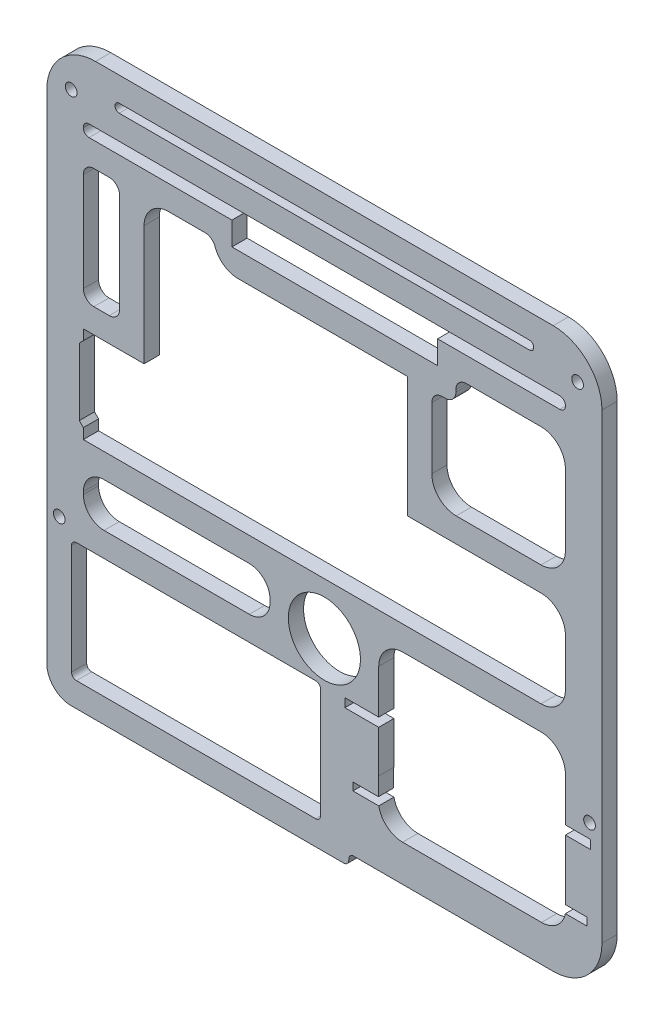
from build123d import *

# Parameters (mm, degrees)
SKETCH1_W           = 57.8674
SKETCH1_H           = 58.2902
SKETCH1_W_2         = 50.2474
SKETCH1_H_2         = 50.6702
BOSS_EXTRUDE1_DEPTH = 1.5875
SKETCH2_W           = 50.2474
SKETCH2_H           = 2.54
SKETCH2_H_2         = 2.1717
BOSS_EXTRUDE2_DEPTH = 1.5875
BOSS_EXTRUDE3_DEPTH = 1.5875
SKETCH4_W           = 11.3284
SKETCH4_H           = 17.169
BOSS_EXTRUDE4_DEPTH = 1.5875
SKETCH5_R           = 3.7592
SKETCH5_W           = 25.9588
SKETCH5_H           = 12.4587
CUT_EXTRUDE1_DEPTH  = 1.5875
SKETCH8_W           = 19.4595
SKETCH8_H           = 2.54
BOSS_EXTRUDE5_DEPTH = 1.5875
FILLET1_R           = 5.08
FILLET2_START       = -1
FILLET2_DEPTH       = 4
FILLET2_2_DEPTH     = 1.5875
FILLET3_R           = 1.0922
FILLET4_R           = 0.5842
FILLET8_R           = 2.159
SKETCH6_R           = 0.6096
CUT_EXTRUDE2_DEPTH  = 1.5875
SKETCH7_W           = 24.384
SKETCH7_H           = 0.8128
SKETCH7_W_2         = 19.05
SKETCH7_H_2         = 1.8796
SKETCH7_W_3         = 25.5778
SKETCH7_H_3         = 0.9144
CUT_EXTRUDE3_DEPTH  = 1.5875
FILLET6_R           = 0.508
SKETCH9_W           = 43.6434
SKETCH9_H           = 0.9017
CUT_EXTRUDE4_DEPTH  = 1.5875
FILLET7_R           = 0.4318
FILLET9_R           = 2.54
SKETCH10_W          = 31.4737
SKETCH10_H          = 1.143
BOSS_EXTRUDE6_DEPTH = 1.5875
FILLET10_R          = 2.54
FILLET11_R          = 0.508


with BuildPart() as part:
    # Sketch1 → Boss-Extrude1 (new body)
    with BuildSketch(Plane.XY):
        with Locations((42.165860751, 32.260946044)):
            Rectangle(SKETCH1_W, SKETCH1_H)
        with Locations((42.165860751, 32.260946044)):
            Rectangle(SKETCH1_W_2, SKETCH1_H_2, mode=Mode.SUBTRACT)
    extrude(amount=BOSS_EXTRUDE1_DEPTH)

    # Sketch2 → Boss-Extrude2 (add)
    with BuildSketch(Plane(origin=(0, 0, 0), x_dir=(-1, 0, 0), z_dir=(0, 0, -1))):
        with Locations((-42.165860751, 25.364846044)):
            Rectangle(SKETCH2_W, SKETCH2_H)
        Polygon((-67.289560751, 54.192446044), (-53.964160751, 54.192446044), (-53.964160751, 51.766746044), (-32.526560751, 51.766746044), (-32.526560751, 54.192446044), (-17.042160751, 54.192446044), (-17.042160751, 51.652446044), (-30.621560751, 51.652446044), (-30.621560751, 49.226746044), (-55.869160751, 49.226746044), (-55.869160751, 51.652446044), (-67.289560751, 51.652446044), align=None)
        with Locations((-42.165860751, 56.510196044)):
            Rectangle(SKETCH2_W, SKETCH2_H_2)
    extrude(amount=-BOSS_EXTRUDE2_DEPTH)

    # Sketch3 → Boss-Extrude3 (add)
    with BuildSketch(Plane(origin=(0, 0, 0), x_dir=(-1, 0, 0), z_dir=(0, 0, -1))):
        Polygon((-57.820560751, 36.634846044), (-50.820560751, 36.634846044), (-50.820560751, 28.408046044), (-50.820560751, 49.226746044), (-53.360560751, 49.226746044), (-53.360560751, 39.174846044), (-67.289560751, 39.174846044), (-67.289560751, 36.634846044), align=None)
        Polygon((-23.370560751, 36.634846044), (-20.120560751, 36.634846044), (-17.042160751, 36.634846044), (-17.042160751, 39.174846044), (-20.830560751, 39.174846044), (-20.830560751, 51.652446044), (-23.370560751, 51.652446044), align=None)
    extrude(amount=-BOSS_EXTRUDE3_DEPTH)

    # Sketch4 → Boss-Extrude4 (add)
    with BuildSketch(Plane(origin=(0, 0, 0), x_dir=(-1, 0, 0), z_dir=(0, 0, -1))):
        with Locations((-42.165860751, 15.510346044)):
            Rectangle(SKETCH4_W, SKETCH4_H)
    extrude(amount=-BOSS_EXTRUDE4_DEPTH)

    # Sketch5 → Cut-Extrude1 (cut)
    with BuildSketch(Plane(origin=(0, 0, 0), x_dir=(-1, 0, 0), z_dir=(0, 0, -1))):
        with Locations((-42.165860751, 21.224646044)):
            Circle(SKETCH5_R)
        with Locations((-28.783160751, 10.742196044)):
            Rectangle(SKETCH5_W, SKETCH5_H)
    extrude(amount=-CUT_EXTRUDE1_DEPTH, mode=Mode.SUBTRACT)

    # Sketch8 → Boss-Extrude5 (add)
    with BuildSketch(Plane(origin=(0, 0, 0), x_dir=(-1, 0, 0), z_dir=(0, 0, -1))):
        with Locations((-26.771910751, 18.241546044)):
            Rectangle(SKETCH8_W, SKETCH8_H)
    extrude(amount=-BOSS_EXTRUDE5_DEPTH)

    # Fillet1
    fillet1_edges = [part.edges().sort_by_distance(p)[0] for p in [
        (13.232160751, 61.406046044, 0.79375),
        (71.099560751, 61.406046044, 0.79375),
        (71.099560751, 3.115846044, 0.79375),
    ]]
    fillet(fillet1_edges, radius=FILLET1_R)

    # Fillet2: read off the stored shape, not the designer's step
    # Fillet2 outline → Fillet2 (cut)
    with BuildSketch(Plane.XY.offset(FILLET2_START)):
        with BuildLine():
            ThreePointArc((33.158987698, 49.226746044), (31.403812778, 49.930728342), (30.621560751, 51.652446044))
            Line((30.621560751, 51.652446044), (30.621560751, 49.226746044))
            Line((30.621560751, 49.226746044), (33.158987698, 49.226746044))
        make_face()
    extrude(amount=FILLET2_DEPTH, mode=Mode.SUBTRACT)

    # Fillet2 2 outline → Fillet2 2 (add)
    with BuildSketch(Plane.XY):
        with BuildLine():
            Line((67.289560751, 36.634846044), (64.749560751, 36.634846044))
            ThreePointArc((64.749560751, 36.634846044), (66.545611975, 35.890897268), (67.289560751, 34.094846044))
            Line((67.289560751, 34.094846044), (67.289560751, 36.634846044))
        make_face()
        with BuildLine():
            Line((67.289560751, 26.634846044), (67.289560751, 29.174846044))
            ThreePointArc((67.289560751, 29.174846044), (66.545611975, 27.37879482), (64.749560751, 26.634846044))
            Line((64.749560751, 26.634846044), (67.289560751, 26.634846044))
        make_face()
        with BuildLine():
            ThreePointArc((23.370560751, 49.112446044), (24.114509527, 50.908497268), (25.910560751, 51.652446044))
            Line((25.910560751, 51.652446044), (23.370560751, 51.652446044))
            Line((23.370560751, 51.652446044), (23.370560751, 49.112446044))
        make_face()
        with BuildLine():
            ThreePointArc((64.749560751, 51.652446044), (66.545611975, 50.908497268), (67.289560751, 49.112446044))
            Line((67.289560751, 49.112446044), (67.289560751, 51.652446044))
            Line((67.289560751, 51.652446044), (64.749560751, 51.652446044))
        make_face()
        with BuildLine():
            Line((53.360560751, 39.174846044), (55.900560751, 39.174846044))
            ThreePointArc((55.900560751, 39.174846044), (54.104509527, 39.91879482), (53.360560751, 41.714846044))
            Line((53.360560751, 41.714846044), (53.360560751, 39.174846044))
        make_face()
        with BuildLine():
            Line((67.289560751, 39.174846044), (67.289560751, 41.714846044))
            ThreePointArc((67.289560751, 41.714846044), (66.545611975, 39.91879482), (64.749560751, 39.174846044))
            Line((64.749560751, 39.174846044), (67.289560751, 39.174846044))
        make_face()
    extrude(amount=FILLET2_2_DEPTH)

    # Fillet3
    fillet3_edges = [part.edges().sort_by_distance(p)[0] for p in [
        (20.830560751, 51.652446044, 0.79375),
        (20.830560751, 39.174846044, 0.79375),
        (17.042160751, 39.174846044, 0.79375),
        (17.042160751, 51.652446044, 0.79375),
        (30.621560751, 51.652446044, 0.79375),
        (55.869160751, 49.226746044, 0.79375),
        (55.869160751, 51.652446044, 0.79375),
        (53.360560751, 49.226746044, 0.79375),
    ]]
    fillet(fillet3_edges, radius=FILLET3_R)

    # Fillet4
    fillet4_edges = [part.edges().sort_by_distance(p)[0] for p in [
        (17.042160751, 54.192446044, 0.79375),
        (67.289560751, 54.192446044, 0.79375),
        (67.289560751, 55.424346044, 0.79375),
        (17.042160751, 55.424346044, 0.79375),
    ]]
    fillet(fillet4_edges, radius=FILLET4_R)

    # Fillet8
    fillet8_edges = [part.edges().sort_by_distance(p)[0] for p in [
        (36.501660751, 24.094846044, 0.79375),
        (36.501660751, 19.511546044, 0.79375),
        (17.042160751, 19.511546044, 0.79375),
        (17.042160751, 24.094846044, 0.79375),
    ]]
    fillet(fillet8_edges, radius=FILLET8_R)

    # Sketch6 → Cut-Extrude2 (cut)
    with BuildSketch(Plane(origin=(0, 0, 0), x_dir=(-1, 0, 0), z_dir=(0, 0, -1))):
        with Locations((-68.559560751, 57.596046044)):
            Circle(SKETCH6_R)
        with Locations((-14.527560751, 18.430646044)):
            Circle(SKETCH6_R)
        with Locations((-69.804160751, 18.430646044)):
            Circle(SKETCH6_R)
        with Locations((-15.772160751, 57.596046044)):
            Circle(SKETCH6_R)
        Polygon((-16.620560751, 28.134846044), (-18.120560751, 26.634846044), (-18.120560751, 36.634846044), (-16.620560751, 35.134846044), align=None)
    extrude(amount=-CUT_EXTRUDE2_DEPTH, mode=Mode.SUBTRACT)

    # Sketch7 → Cut-Extrude3 (cut)
    with BuildSketch(Plane(origin=(0, 0, 0), x_dir=(-1, 0, 0), z_dir=(0, 0, -1))):
        with Locations((-57.328560751, 9.368745978)):
            Rectangle(SKETCH7_W, SKETCH7_H)
        with Locations((-57.328560751, 10.714945978)):
            Rectangle(SKETCH7_W_2, SKETCH7_H_2)
        with Locations((-57.091460751, 16.514346044)):
            Rectangle(SKETCH7_W_3, SKETCH7_H_3)
    extrude(amount=-CUT_EXTRUDE3_DEPTH, mode=Mode.SUBTRACT)

    # Fillet6
    fillet6_edges = [part.edges().sort_by_distance(p)[0] for p in [
        (15.803760751, 16.971546044, 0.79375),
        (15.803760751, 4.512846044, 0.79375),
        (41.762560751, 4.512846044, 0.79375),
        (41.762560751, 16.971546044, 0.79375),
    ]]
    fillet(fillet6_edges, radius=FILLET6_R)

    # Sketch9 → Cut-Extrude4 (cut)
    with BuildSketch(Plane.XY.offset(1.5875)):
        with Locations((42.165860751, 58.415196044)):
            Rectangle(SKETCH9_W, SKETCH9_H)
    extrude(amount=-CUT_EXTRUDE4_DEPTH, mode=Mode.SUBTRACT)

    # Fillet7
    fillet7_edges = [part.edges().sort_by_distance(p)[0] for p in [
        (63.987560751, 57.964346044, 0.79375),
        (63.987560751, 58.866046044, 0.79375),
        (20.344160751, 58.866046044, 0.79375),
        (20.344160751, 57.964346044, 0.79375),
    ]]
    fillet(fillet7_edges, radius=FILLET7_R)

    # Fillet9
    # the kernel refuses this fillet: 2.54 mm, written as the material it adds along each edge
    with BuildSketch(Plane(origin=(47.830060751, 6.925846044, 0), x_dir=(1, 0, 0), z_dir=(0, 0, 1))) as fillet9_piece_1:
        with BuildLine():
            CenterArc((2.489595888, 2.54), FILLET9_R, 191.433378163, 78.566621837)
            Line((0, 2.036499934), (-0.049791918, 2.026429933))
            ThreePointArc((-0.049791918, 2.026429933), (-0.0508, 1.018249967), (-0.0508, 0))
            Line((-0.0508, 0), (0, -0.0508))
            Line((0, -0.0508), (2.489595888, -0.0508))
            Line((2.489595888, -0.0508), (2.489595888, 0))
        make_face()
    extrude(amount=1.5875)
    with BuildSketch(Plane(origin=(47.830060751, 24.094846044, 0), x_dir=(1, 0, 0), z_dir=(0, 0, 1)), Plane(origin=(67.289560751, 24.094846044, 0), x_dir=(0, -1, 0), z_dir=(0, 0, 1))) as fillet9_piece_2:
        with BuildLine():
            CenterArc((FILLET9_R, -FILLET9_R), FILLET9_R, 90, 90)
            Line((0, -FILLET9_R), (-FILLET9_R * 0.02, -FILLET9_R))
            Line((-FILLET9_R * 0.02, -FILLET9_R), (-FILLET9_R * 0.02, FILLET9_R * 0.02))
            Line((-FILLET9_R * 0.02, FILLET9_R * 0.02), (FILLET9_R, FILLET9_R * 0.02))
            Line((FILLET9_R, FILLET9_R * 0.02), (FILLET9_R, 0))
        make_face()
    extrude(amount=1.5875)
    with BuildSketch(Plane(origin=(67.289560751, 6.925846044, 0), x_dir=(-1.3886374564076336e-12, 1.0, 0), z_dir=(0, 0, 1))) as fillet9_piece_3:
        with BuildLine():
            CenterArc((2.54, 2.489595888), FILLET9_R, 180, 78.566621837)
            Line((0, 2.489595888), (-0.0508, 2.489595888))
            Line((-0.0508, 2.489595888), (-0.0508, 0))
            Line((-0.0508, 0), (0, -0.0508))
            ThreePointArc((0, -0.0508), (1.018249967, -0.0508), (2.026429933, -0.049791918))
            Line((2.026429933, -0.049791918), (2.036499934, 0))
        make_face()
    extrude(amount=1.5875)

    # Sketch10 → Boss-Extrude6 (add)
    with BuildSketch(Plane.XY.offset(1.5875)):
        with Locations((28.969010751, 2.544346044)):
            Rectangle(SKETCH10_W, SKETCH10_H)
    extrude(amount=-BOSS_EXTRUDE6_DEPTH)

    # Fillet10
    fillet10_edges = [part.edges().sort_by_distance(p)[0] for p in [
        (13.232160751, 1.972846044, 0.79375),
    ]]
    fillet(fillet10_edges, radius=FILLET10_R)

    # Fillet11
    fillet11_edges = [part.edges().sort_by_distance(p)[0] for p in [
        (44.705860751, 1.972846044, 0.79375),
        (44.705860751, 3.115846044, 0.79375),
    ]]
    fillet(fillet11_edges, radius=FILLET11_R)


solid = part.part
